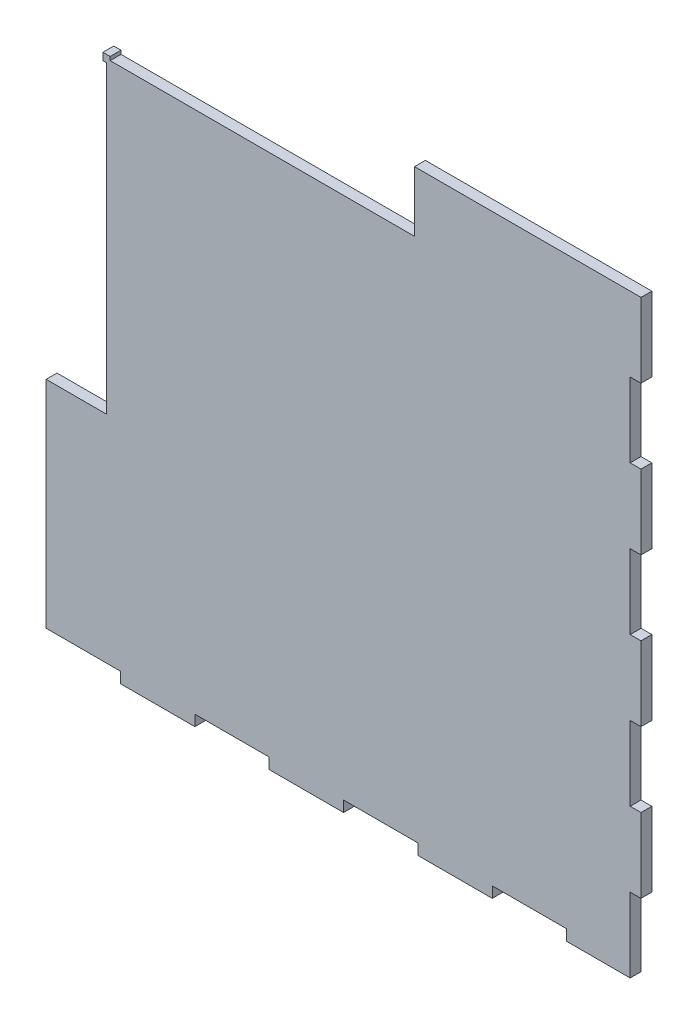
from build123d import *

# Parameters (mm, degrees)
BOSS_EXTRUDE1_DEPTH = 4.5593
CAVITY1_START       = -112.395
CAVITY1_OUTLINE_W   = 4.5593
CAVITY1_OUTLINE_H   = 4.5593
CAVITY1_OUTLINE_W_2 = 31.27375
CAVITY1_DEPTH       = 4.5593
CAVITY1_START_2     = -49.8475
CAVITY1_2_OUTLINE_W = 4.5593
CAVITY1_2_OUTLINE_H = 4.5593
CAVITY1_2_DEPTH     = 31.27375
CAVITY1_START_3     = 12.7
CAVITY1_3_OUTLINE_W = 4.5593
CAVITY1_3_OUTLINE_H = 4.5593
CAVITY1_3_DEPTH     = 31.27375
CAVITY1_START_4     = 75.2475
CAVITY1_4_OUTLINE_W = 4.5593
CAVITY1_4_OUTLINE_H = 4.5593
CAVITY1_4_DEPTH     = 31.27375
CAVITY1_START_5     = -107.8357
CAVITY1_5_OUTLINE_W = 4.5593
CAVITY1_5_OUTLINE_H = 4.5593
CAVITY1_5_DEPTH     = 26.71445


# Read off the part's stored shape, not the designer's step: Cavity1
with BuildPart() as part:
    # Sketch1 → Boss-Extrude1 (new body)
    with BuildSketch(Plane.XY):
        Polygon((-112.395, -17.145), (-137.795, -17.145), (-137.795, -112.395), (112.395, -112.395), (112.395, 112.395), (112.395, 137.795), (17.145, 137.795), (17.145, 112.395), (-110.871, 112.395), (-110.871, 113.919), (-113.919, 113.919), (-113.919, 110.871), (-112.395, 110.871), align=None)
    extrude(amount=BOSS_EXTRUDE1_DEPTH)

    # Cavity1 outline → Cavity1 (cut)
    with BuildSketch(Plane(origin=(0, 0, 0), x_dir=(1, 0, 0), z_dir=(0, 1, 0)).offset(CAVITY1_START)):
        with Locations((110.11535, -2.27965)):
            Rectangle(CAVITY1_OUTLINE_W, CAVITY1_OUTLINE_H)
        with Locations((65.484375, -2.27965)):
            Rectangle(CAVITY1_OUTLINE_W_2, CAVITY1_OUTLINE_H)
        with Locations((2.936875, -2.27965)):
            Rectangle(CAVITY1_OUTLINE_W_2, CAVITY1_OUTLINE_H)
        with Locations((-59.610625, -2.27965)):
            Rectangle(CAVITY1_OUTLINE_W_2, CAVITY1_OUTLINE_H)
        with Locations((-122.158125, -2.27965)):
            Rectangle(CAVITY1_OUTLINE_W_2, CAVITY1_OUTLINE_H)
    extrude(amount=CAVITY1_DEPTH, mode=Mode.SUBTRACT)

    # Cavity1 2 outline → Cavity1 2 (cut)
    with BuildSketch(Plane(origin=(0, 0, 0), x_dir=(1, 0, 0), z_dir=(0, 1, 0)).offset(CAVITY1_START_2)):
        with Locations((110.11535, -2.27965)):
            Rectangle(CAVITY1_2_OUTLINE_W, CAVITY1_2_OUTLINE_H)
    extrude(amount=CAVITY1_2_DEPTH, mode=Mode.SUBTRACT)

    # Cavity1 3 outline → Cavity1 3 (cut)
    with BuildSketch(Plane(origin=(0, 0, 0), x_dir=(1, 0, 0), z_dir=(0, 1, 0)).offset(CAVITY1_START_3)):
        with Locations((110.11535, -2.27965)):
            Rectangle(CAVITY1_3_OUTLINE_W, CAVITY1_3_OUTLINE_H)
    extrude(amount=CAVITY1_3_DEPTH, mode=Mode.SUBTRACT)

    # Cavity1 4 outline → Cavity1 4 (cut)
    with BuildSketch(Plane(origin=(0, 0, 0), x_dir=(1, 0, 0), z_dir=(0, 1, 0)).offset(CAVITY1_START_4)):
        with Locations((110.11535, -2.27965)):
            Rectangle(CAVITY1_4_OUTLINE_W, CAVITY1_4_OUTLINE_H)
    extrude(amount=CAVITY1_4_DEPTH, mode=Mode.SUBTRACT)

    # Cavity1 5 outline → Cavity1 5 (cut)
    with BuildSketch(Plane(origin=(0, 0, 0), x_dir=(1, 0, 0), z_dir=(0, 1, 0)).offset(CAVITY1_START_5)):
        with Locations((110.11535, -2.27965)):
            Rectangle(CAVITY1_5_OUTLINE_W, CAVITY1_5_OUTLINE_H)
    extrude(amount=CAVITY1_5_DEPTH, mode=Mode.SUBTRACT)


solid = part.part
